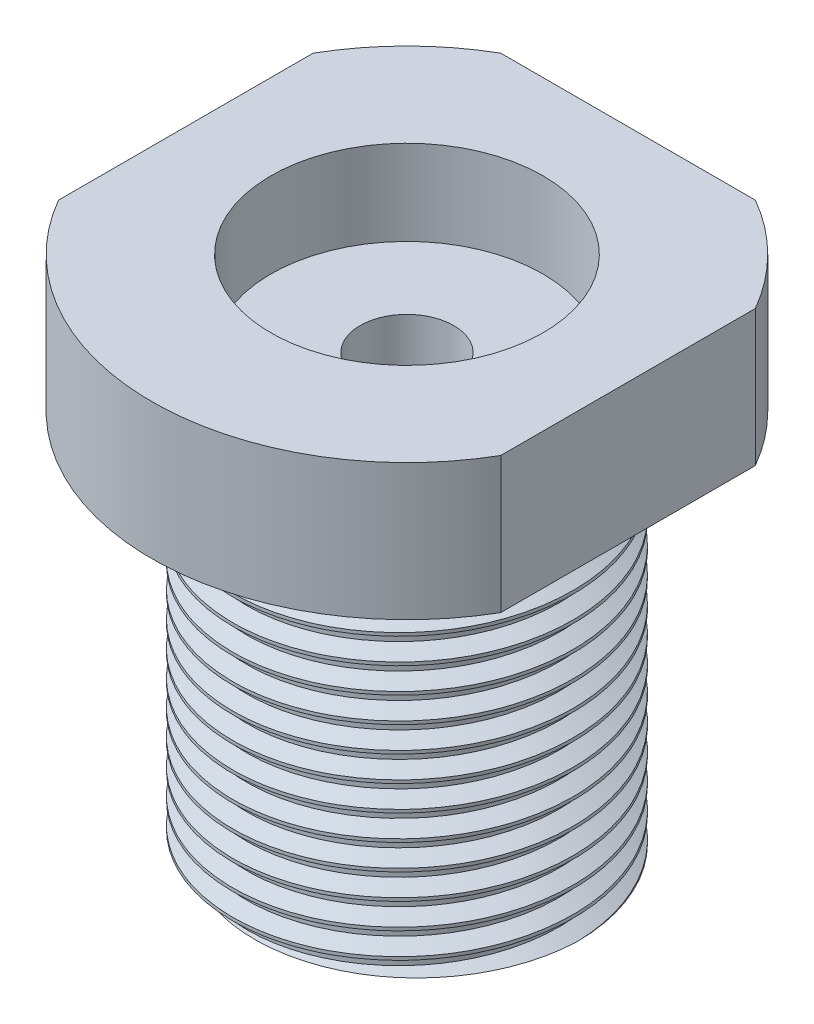
from build123d import *

# Parameters (mm, degrees)
THREAD1_PITCH      = 1.5
CUT_EXTRUDE1_START = -22
CUT_EXTRUDE1_DEPTH = 22
SKETCH3_R          = 1.5
CUT_EXTRUDE2_DEPTH = 4


with BuildPart() as part:
    # Sketch1 → Revolve1 (revolve)
    with BuildSketch(Plane(origin=(0, 0, 0), x_dir=(0, 0, -1), z_dir=(1, 0, 0))):
        Polygon((15, 30), (15, 22), (10, 22), (10, 0), (8, 0), (8, 5), (2.75, 5), (2.75, 25), (8, 25), (8, 30), align=None)
    revolve(axis=Axis((0, 0, 0), (0, 1, 0)))

    # Thread1: the profile of Thread Profile1 profile screwed along a right-hand helix of 17.333333 turns, 8 arcs to a turn; built about Z, then put on its axis
    thread1_z = Axis((0, 0, 0), (0, 0, 1))
    thread1_corners = [(10.0003, 0, -0.000173205), (10.0003, 0, 1.312673201), (9.188101188, 0, 0.843749998), (9.188101188, 0, 0.468749998)]
    with BuildLine(mode=Mode.PRIVATE) as thread1_profile:
        Line(thread1_corners[0], thread1_corners[1])
        Line(thread1_corners[1], thread1_corners[2])
        Line(thread1_corners[2], thread1_corners[3])
        Line(thread1_corners[3], thread1_corners[0])
    thread1_cap = Face(thread1_profile.wire())
    thread1_turn_angles = [0, 22.5, 45, 67.5, 90, 112.5, 135, 157.5, 180, 202.5, 225, 247.5, 270, 292.5, 315, 337.5, 360]
    thread1_turn_weights = [1, 0.9238795325112867, 1, 0.9238795325112867, 1, 0.9238795325112867, 1, 0.9238795325112867, 1, 0.9238795325112867, 1, 0.9238795325112867, 1, 0.9238795325112867, 1, 0.9238795325112867, 1]
    thread1_turn_rails = [Edge.make_bspline([Vector(p[0], p[1], 0).rotate(thread1_z, thread1_turn_angles[k]) / thread1_turn_weights[k] + Vector(0, 0, p[2] + THREAD1_PITCH * thread1_turn_angles[k] / 360) for k in range(17)], [0, 0, 0, 1, 1, 2, 2, 3, 3, 4, 4, 5, 5, 6, 6, 7, 7, 8, 8, 8], 2, thread1_turn_weights) for p in thread1_corners]
    thread1_turn_sides = [Face.make_surface_from_curves(thread1_turn_rails[p[0]], thread1_turn_rails[p[1]]) for p in [(0, 1), (1, 2), (2, 3), (3, 0)]]
    thread1_last_angles = [6120, 6142.5, 6165, 6187.5, 6210, 6225, 6240]
    thread1_last_weights = [1, 0.9238795325112867, 1, 0.9238795325112867, 1, 0.9659258262890642, 1]
    thread1_last_rails = [Edge.make_bspline([Vector(p[0], p[1], 0).rotate(thread1_z, thread1_last_angles[k]) / thread1_last_weights[k] + Vector(0, 0, p[2] + THREAD1_PITCH * thread1_last_angles[k] / 360) for k in range(7)], [0, 0, 0, 1, 1, 2, 2, 3, 3, 3], 2, thread1_last_weights) for p in thread1_corners]
    thread1_last_sides = [Face.make_surface_from_curves(thread1_last_rails[p[0]], thread1_last_rails[p[1]]) for p in [(0, 1), (1, 2), (2, 3), (3, 0)]]
    thread1 = Plane(origin=(0, -3, 0), x_dir=(1, 0, 0), z_dir=(0, 1, 0)) * Solid(Shell([*[p.moved(Location((0, 0, THREAD1_PITCH * i))) for i in range(17) for p in thread1_turn_sides], *thread1_last_sides, thread1_cap, thread1_cap.rotate(thread1_z, 6240).moved(Location((0, 0, THREAD1_PITCH * 6240 / 360)))]))
    add(thread1, mode=Mode.SUBTRACT)

    # Sketch2 → Cut-Extrude1 (cut)
    with BuildSketch(Plane(origin=(0, 30, 0), x_dir=(1, 0, 0), z_dir=(0, 1, 0)).offset(CUT_EXTRUDE1_START)):
        with BuildLine():
            Line((13, 7.483314774), (13, -7.483314774))
            ThreePointArc((13, -7.483314774), (15, 0), (13, 7.483314774))
        make_face()
        with BuildLine():
            Line((7.483314774, 13), (-7.483314774, 13))
            ThreePointArc((-7.483314774, 13), (0, 15), (7.483314774, 13))
        make_face()
        with BuildLine():
            Line((-13, 7.483314774), (-13, -7.483314774))
            ThreePointArc((-13, -7.483314774), (-15, 0), (-13, 7.483314774))
        make_face()
    extrude(amount=CUT_EXTRUDE1_DEPTH, mode=Mode.SUBTRACT)

    # Sketch3 → Cut-Extrude2 (cut)
    with BuildSketch(Plane(origin=(0, 0, -13), x_dir=(-1, 0, 0), z_dir=(0, 0, -1))):
        with Locations((0, 26)):
            Circle(SKETCH3_R)
    extrude(amount=-CUT_EXTRUDE2_DEPTH, mode=Mode.SUBTRACT)


solid = part.part
